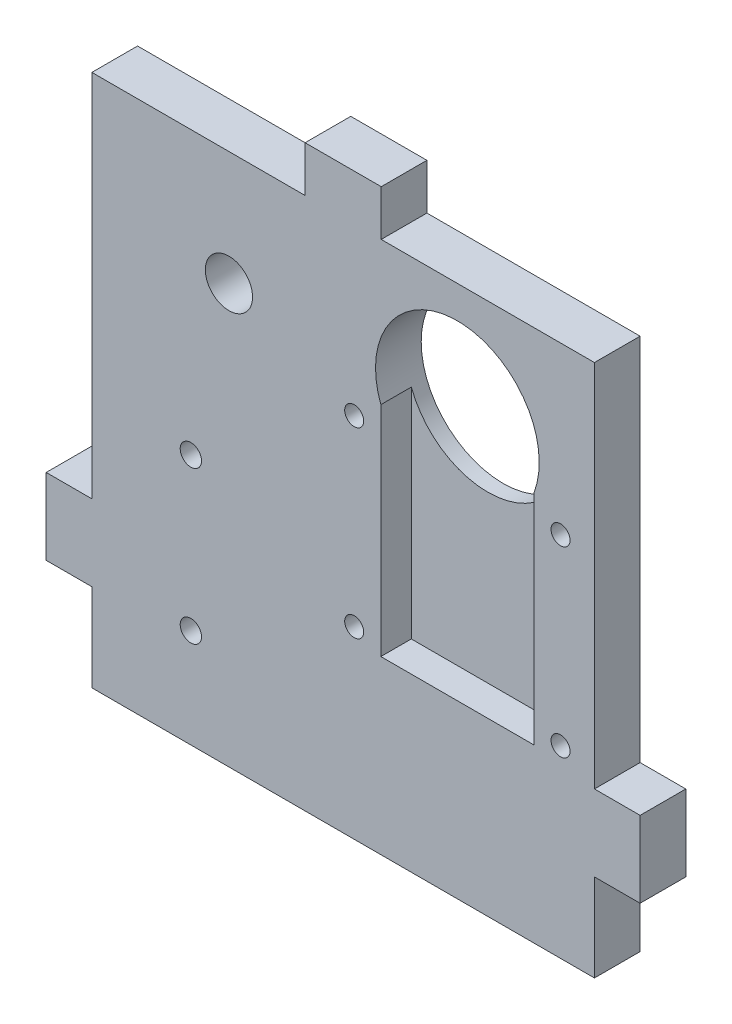
from build123d import *

# Parameters (mm, degrees)
ESQUISSE1_W             = 66
ESQUISSE1_H             = 70
ESQUISSE1_R             = 1.4
ESQUISSE1_R_2           = 3.1
BOSS_EXTRU_1_DEPTH      = 6
ESQUISSE2_W             = 10
ESQUISSE2_H             = 6
ESQUISSE2_W_2           = 6
ESQUISSE2_H_2           = 10
BOSS_EXTRU_3_DEPTH      = 6
ENL_V_START             = -4
ENL_V_MAT_EXTRU_3_DEPTH = 4
ESQUISSE4_R             = 1.25
ENL_V_MAT_EXTRU_4_DEPTH = 6


with BuildPart() as part:
    # Esquisse1 → Boss.-Extru.1 (new body)
    with BuildSketch(Plane.XY):
        with Locations((0, -20)):
            Rectangle(ESQUISSE1_W, ESQUISSE1_H)
        with Locations((-20, -42)):
            Circle(ESQUISSE1_R, mode=Mode.SUBTRACT)
        with Locations((-20, -22)):
            Circle(ESQUISSE1_R, mode=Mode.SUBTRACT)
        with Locations((-15, 0)):
            Circle(ESQUISSE1_R_2, mode=Mode.SUBTRACT)
        with BuildLine():
            ThreePointArc((25.75, 0), (15, -10.75), (4.25, 0))
            ThreePointArc((4.25, 0), (15, 10.75), (25.75, 0))
        make_face(mode=Mode.SUBTRACT)
    extrude(amount=BOSS_EXTRU_1_DEPTH)

    # Esquisse2 → Boss.-Extru.3 (add)
    with BuildSketch(Plane.XY.offset(6)):
        with Locations((0, 18)):
            Rectangle(ESQUISSE2_W, ESQUISSE2_H)
        with Locations((-36, -38.5)):
            Rectangle(ESQUISSE2_W_2, ESQUISSE2_H_2)
        with Locations((36, -38.5)):
            Rectangle(ESQUISSE2_W_2, ESQUISSE2_H_2)
    extrude(amount=-BOSS_EXTRU_3_DEPTH)

    # Esquisse3 → Enlèv. mat.-Extru.3 (cut)
    with BuildSketch(Plane.XY.offset(6).offset(ENL_V_START)):
        with BuildLine():
            Line((4.95, -3.815756806), (4.95, -32.465756806))
            Line((4.95, -32.465756806), (25.05, -32.465756806))
            Line((25.05, -32.465756806), (25.05, -3.815756806))
            ThreePointArc((25.05, -3.815756806), (15, -10.75), (4.95, -3.815756806))
        make_face()
    extrude(amount=ENL_V_MAT_EXTRU_3_DEPTH, mode=Mode.SUBTRACT)

    # Esquisse4 → Enlèv. mat.-Extru.4 (cut)
    with BuildSketch(Plane.XY.offset(6)):
        with Locations((28.55, -6.815756806)):
            Circle(ESQUISSE4_R)
        with Locations((28.55, -30.815756806)):
            Circle(ESQUISSE4_R)
        with Locations((1.45, -30.815756806)):
            Circle(ESQUISSE4_R)
        with Locations((1.45, -6.815756806)):
            Circle(ESQUISSE4_R)
    extrude(amount=-ENL_V_MAT_EXTRU_4_DEPTH, mode=Mode.SUBTRACT)


solid = part.part
